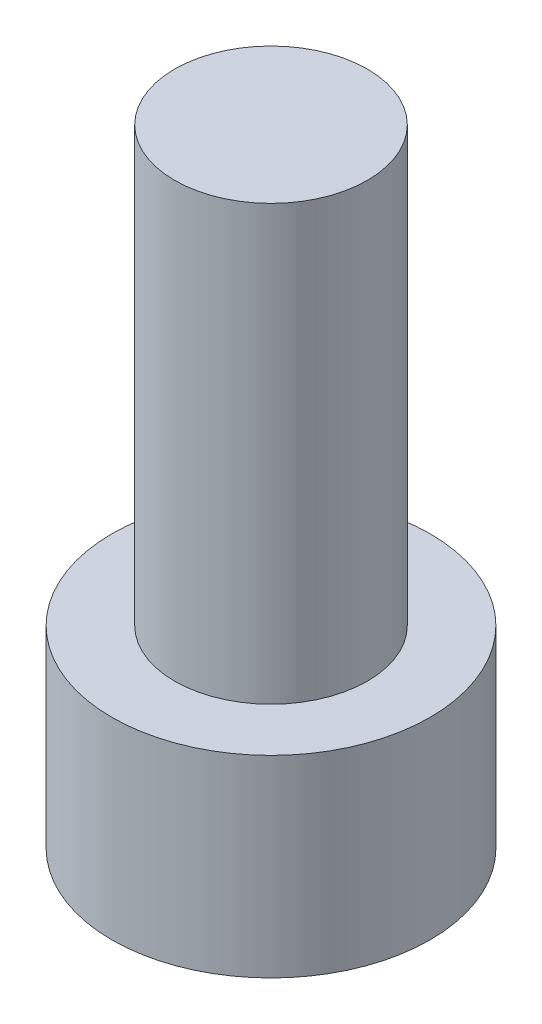
from build123d import *

# Parameters (mm, degrees)
SKETCH_1_R          = 6.6
EXTRUDE_1_DEPTH     = 8
SKETCH_2_R          = 4
EXTRUDE_2_DEPTH     = 18
CUT_EXTRUDE_1_DEPTH = 4


with BuildPart() as part:
    # 草图1 → 凸台-拉伸1 (new body)
    with BuildSketch(Plane(origin=(0, 0, 0), x_dir=(1, 0, 0), z_dir=(0, 1, 0))):
        Circle(SKETCH_1_R)
    extrude(amount=EXTRUDE_1_DEPTH)

    # 草图2 → 凸台-拉伸2 (add)
    with BuildSketch(Plane(origin=(0, 8, 0), x_dir=(1, 0, 0), z_dir=(0, 1, 0))):
        Circle(SKETCH_2_R)
    extrude(amount=EXTRUDE_2_DEPTH)

    # 草图3 → 切除-拉伸1 (cut)
    with BuildSketch(Plane.XZ):
        Polygon((3.46061635, 0.155352746), (1.59576875, 3.074658045), (-1.8648476, 2.919305299), (-3.46061635, -0.155352746), (-1.59576875, -3.074658045), (1.8648476, -2.919305299), align=None)
    extrude(amount=-CUT_EXTRUDE_1_DEPTH, mode=Mode.SUBTRACT)


solid = part.part
